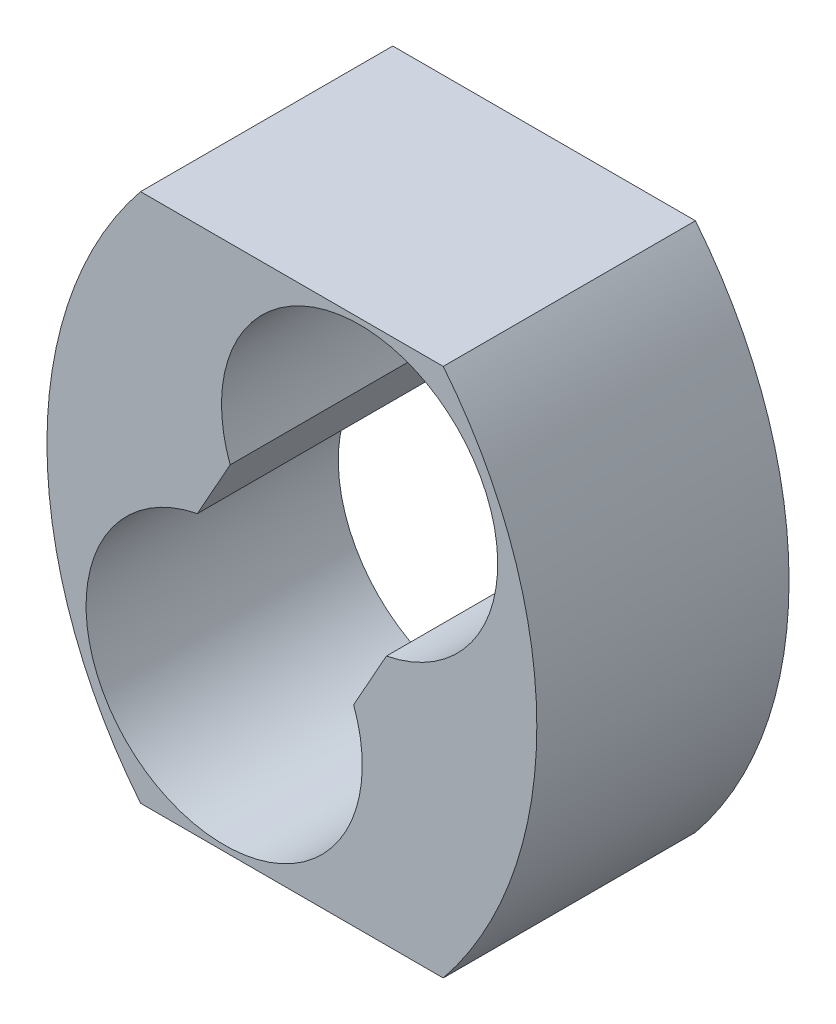
from build123d import *

# Parameters (mm, degrees)
SALIENTE_EXTRUIR4_DEPTH = 10


with BuildPart() as part:
    # Croquis3 → Saliente-Extruir4 (new body)
    with BuildSketch(Plane.XY):
        with BuildLine():
            ThreePointArc((-6, 10.5), (-9.710774967, 0), (-6, -10.5))
            Line((-6, -10.5), (6, -10.5))
            ThreePointArc((6, -10.5), (9.710774967, 0), (6, 10.5))
            Line((6, 10.5), (-6, 10.5))
        make_face()
        with BuildLine():
            Line((3.747745809, -0.571546655), (2.448257672, -2.894529081))
            ThreePointArc((2.448257672, -2.894529081), (-5.358395973, -9.578740522), (-3.747745809, 0.571546655))
            Line((-3.747745809, 0.571546655), (-2.448257672, 2.894529081))
            ThreePointArc((-2.448257672, 2.894529081), (5.358395973, 9.578740522), (3.747745809, -0.571546655))
        make_face(mode=Mode.SUBTRACT)
    extrude(amount=SALIENTE_EXTRUIR4_DEPTH)


solid = part.part
